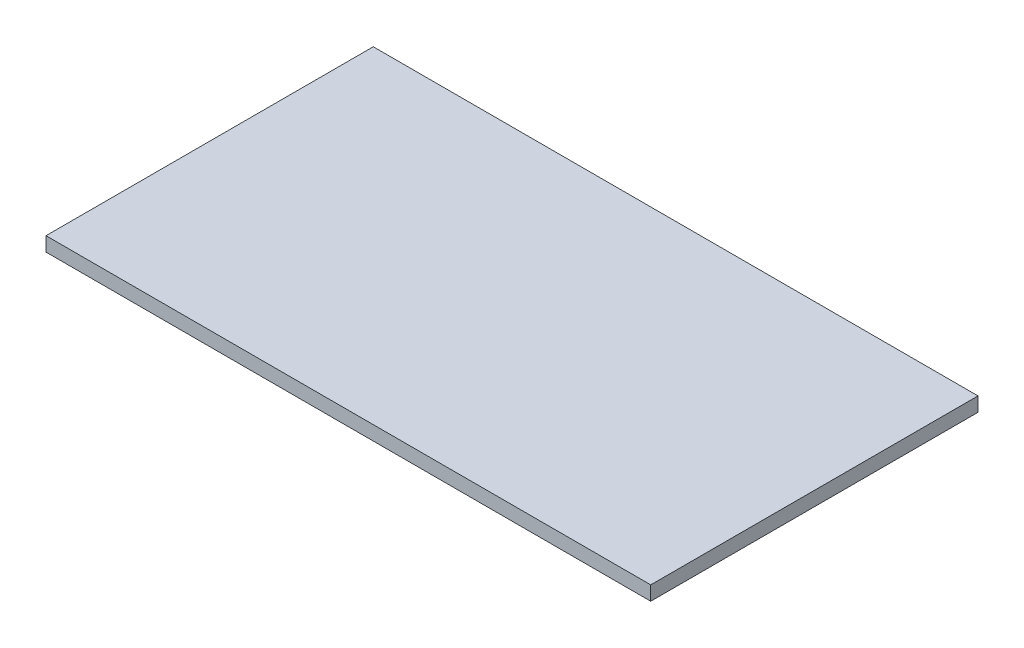
from build123d import *

# Parameters (mm, degrees)
SKETCH_1_W      = 85
SKETCH_1_H      = 46
EXTRUDE_1_DEPTH = 2


with BuildPart() as part:
    # 草图1 → 凸台-拉伸1 (new body)
    with BuildSketch(Plane(origin=(0, 0, 0), x_dir=(1, 0, 0), z_dir=(0, 1, 0))):
        Rectangle(SKETCH_1_W, SKETCH_1_H)
    extrude(amount=EXTRUDE_1_DEPTH)


solid = part.part
